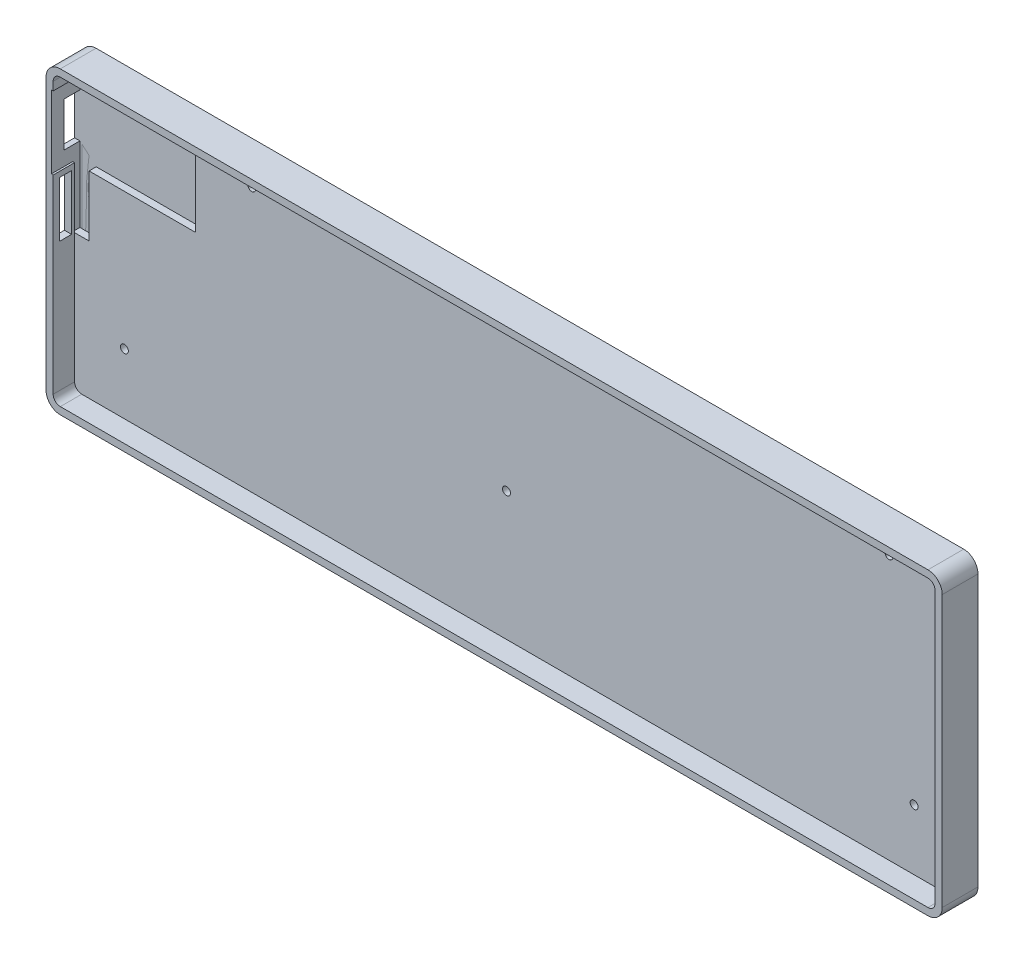
from build123d import *

# Parameters (mm, degrees)
SKETCH1_R                = 1.1
SKETCH1_R_2              = 0.95
SKETCH1_R_3              = 2.05
SKETCH1_R_4              = 1.5
SKETCH1_R_5              = 0.15
SKETCH1_R_6              = 0.5
SKETCH1_R_7              = 0.45
SKETCH1_R_8              = 1.524
SKETCH1_R_9              = 1.9939
SKETCH1_R_10             = 0.375
BOSS_EXTRUDE1_DEPTH      = 1.6
BOSS_EXTRUDE2_DEPTH      = 8
BOSS_EXTRUDE2_DEPTH_BACK = 2
BOSS_EXTRUDE5_DEPTH      = 2
BOSS_EXTRUDE5_DEPTH_BACK = 2
BOSS_EXTRUDE5_START      = 1.6
SKETCH5_R                = 1.105991344
SKETCH5_R_2              = 1.113799343
SKETCH5_R_3              = 1.1
SKETCH6_W                = 32.534762887
SKETCH6_H                = 20.354663213
CUT_EXTRUDE1_DEPTH       = 2
SKETCH7_W                = 4.5
SKETCH7_H                = 12.354663213
CUT_EXTRUDE2_DEPTH       = 313.254874697
CUT_EXTRUDE3_DEPTH       = 10
CUT_EXTRUDE3_DEPTH_BACK  = 2
SKETCH9_W                = 4.56033848
SKETCH9_H                = 16.973436805
CUT_EXTRUDE4_DEPTH       = 2
SKETCH11_W               = 3.429739467
SKETCH11_H               = 15.458393228
CUT_EXTRUDE6_DEPTH       = 2


with BuildPart() as part:
    # Sketch1 → Boss-Extrude1 (new body)
    with BuildSketch(Plane.XY.offset(1.6)):
        with BuildLine():
            Line((342.620001494, -108.45), (99.949998506, -108.45))
            ThreePointArc((99.949998506, -108.45), (98.535786, -109.035786), (97.95, -110.449998506))
            Line((97.95, -110.449998506), (97.95, -186.250001494))
            ThreePointArc((97.95, -186.250001494), (98.535786, -187.664214), (99.949998506, -188.25))
            Line((99.949998506, -188.25), (342.620001494, -188.25))
            ThreePointArc((342.620001494, -188.25), (344.034214, -187.664214), (344.62, -186.250001494))
            Line((344.62, -186.250001494), (344.62, -110.449998506))
            ThreePointArc((344.62, -110.449998506), (344.034214, -109.035786), (342.620001494, -108.45))
        make_face()
        with Locations((325.72, -114.3)):
            Circle(SKETCH1_R, mode=Mode.SUBTRACT)
        with Locations((330.8, -120)):
            Circle(SKETCH1_R_2, mode=Mode.SUBTRACT)
        with Locations((325.72, -120)):
            Circle(SKETCH1_R_3, mode=Mode.SUBTRACT)
        with Locations((320.64, -120)):
            Circle(SKETCH1_R_2, mode=Mode.SUBTRACT)
        with Locations((304.58, -120)):
            Circle(SKETCH1_R_2, mode=Mode.SUBTRACT)
        with Locations((299.5, -120)):
            Circle(SKETCH1_R_3, mode=Mode.SUBTRACT)
        with Locations((294.42, -120)):
            Circle(SKETCH1_R_2, mode=Mode.SUBTRACT)
        with Locations((285.58, -120)):
            Circle(SKETCH1_R_2, mode=Mode.SUBTRACT)
        with Locations((280.5, -120)):
            Circle(SKETCH1_R_3, mode=Mode.SUBTRACT)
        with Locations((329.53, -122.54)):
            Circle(SKETCH1_R_4, mode=Mode.SUBTRACT)
        with Locations((323.18, -125.08)):
            Circle(SKETCH1_R_4, mode=Mode.SUBTRACT)
        with Locations((327.37, -129)):
            Circle(SKETCH1_R_5, mode=Mode.SUBTRACT)
        with Locations((324.07, -129)):
            Circle(SKETCH1_R_5, mode=Mode.SUBTRACT)
        with Locations((303.31, -122.54)):
            Circle(SKETCH1_R_4, mode=Mode.SUBTRACT)
        with Locations((296.96, -125.08)):
            Circle(SKETCH1_R_4, mode=Mode.SUBTRACT)
        with Locations((284.31, -122.54)):
            Circle(SKETCH1_R_4, mode=Mode.SUBTRACT)
        with Locations((301.15, -129)):
            Circle(SKETCH1_R_5, mode=Mode.SUBTRACT)
        with Locations((297.85, -129)):
            Circle(SKETCH1_R_5, mode=Mode.SUBTRACT)
        with Locations((282.15, -129)):
            Circle(SKETCH1_R_5, mode=Mode.SUBTRACT)
        with Locations((275.42, -120)):
            Circle(SKETCH1_R_2, mode=Mode.SUBTRACT)
        with Locations((266.58, -120)):
            Circle(SKETCH1_R_2, mode=Mode.SUBTRACT)
        with Locations((261.5, -120)):
            Circle(SKETCH1_R_3, mode=Mode.SUBTRACT)
        with Locations((256.42, -120)):
            Circle(SKETCH1_R_2, mode=Mode.SUBTRACT)
        with Locations((247.58, -120)):
            Circle(SKETCH1_R_2, mode=Mode.SUBTRACT)
        with Locations((242.5, -120)):
            Circle(SKETCH1_R_3, mode=Mode.SUBTRACT)
        with Locations((237.42, -120)):
            Circle(SKETCH1_R_2, mode=Mode.SUBTRACT)
        with Locations((228.58, -120)):
            Circle(SKETCH1_R_2, mode=Mode.SUBTRACT)
        with Locations((223.5, -120)):
            Circle(SKETCH1_R_3, mode=Mode.SUBTRACT)
        with Locations((265.31, -122.54)):
            Circle(SKETCH1_R_4, mode=Mode.SUBTRACT)
        with Locations((277.96, -125.08)):
            Circle(SKETCH1_R_4, mode=Mode.SUBTRACT)
        with Locations((258.96, -125.08)):
            Circle(SKETCH1_R_4, mode=Mode.SUBTRACT)
        with Locations((278.85, -129)):
            Circle(SKETCH1_R_5, mode=Mode.SUBTRACT)
        with Locations((263.15, -129)):
            Circle(SKETCH1_R_5, mode=Mode.SUBTRACT)
        with Locations((259.85, -129)):
            Circle(SKETCH1_R_5, mode=Mode.SUBTRACT)
        with Locations((246.31, -122.54)):
            Circle(SKETCH1_R_4, mode=Mode.SUBTRACT)
        with Locations((239.96, -125.08)):
            Circle(SKETCH1_R_4, mode=Mode.SUBTRACT)
        with Locations((227.31, -122.54)):
            Circle(SKETCH1_R_4, mode=Mode.SUBTRACT)
        with Locations((220.96, -125.08)):
            Circle(SKETCH1_R_4, mode=Mode.SUBTRACT)
        with Locations((244.15, -129)):
            Circle(SKETCH1_R_5, mode=Mode.SUBTRACT)
        with Locations((240.85, -129)):
            Circle(SKETCH1_R_5, mode=Mode.SUBTRACT)
        with Locations((225.15, -129)):
            Circle(SKETCH1_R_5, mode=Mode.SUBTRACT)
        with Locations((221.85, -129)):
            Circle(SKETCH1_R_5, mode=Mode.SUBTRACT)
        with Locations((333.08, -139)):
            Circle(SKETCH1_R_2, mode=Mode.SUBTRACT)
        with Locations((328, -139)):
            Circle(SKETCH1_R_3, mode=Mode.SUBTRACT)
        with Locations((322.92, -139)):
            Circle(SKETCH1_R_2, mode=Mode.SUBTRACT)
        with Locations((309.33, -139)):
            Circle(SKETCH1_R_2, mode=Mode.SUBTRACT)
        with Locations((304.25, -139)):
            Circle(SKETCH1_R_3, mode=Mode.SUBTRACT)
        with Locations((299.17, -139)):
            Circle(SKETCH1_R_2, mode=Mode.SUBTRACT)
        with Locations((290.33, -139)):
            Circle(SKETCH1_R_2, mode=Mode.SUBTRACT)
        with Locations((285.25, -139)):
            Circle(SKETCH1_R_3, mode=Mode.SUBTRACT)
        with Locations((280.17, -139)):
            Circle(SKETCH1_R_2, mode=Mode.SUBTRACT)
        with Locations((331.81, -141.54)):
            Circle(SKETCH1_R_4, mode=Mode.SUBTRACT)
        with Locations((325.46, -144.08)):
            Circle(SKETCH1_R_4, mode=Mode.SUBTRACT)
        with Locations((329.65, -148)):
            Circle(SKETCH1_R_5, mode=Mode.SUBTRACT)
        with Locations((326.35, -148)):
            Circle(SKETCH1_R_5, mode=Mode.SUBTRACT)
        with Locations((308.06, -141.54)):
            Circle(SKETCH1_R_4, mode=Mode.SUBTRACT)
        with Locations((301.71, -144.08)):
            Circle(SKETCH1_R_4, mode=Mode.SUBTRACT)
        with Locations((289.06, -141.54)):
            Circle(SKETCH1_R_4, mode=Mode.SUBTRACT)
        with Locations((282.71, -144.08)):
            Circle(SKETCH1_R_4, mode=Mode.SUBTRACT)
        with Locations((305.9, -148)):
            Circle(SKETCH1_R_5, mode=Mode.SUBTRACT)
        with Locations((302.6, -148)):
            Circle(SKETCH1_R_5, mode=Mode.SUBTRACT)
        with Locations((286.9, -148)):
            Circle(SKETCH1_R_5, mode=Mode.SUBTRACT)
        with Locations((283.6, -148)):
            Circle(SKETCH1_R_5, mode=Mode.SUBTRACT)
        with Locations((271.33, -139)):
            Circle(SKETCH1_R_2, mode=Mode.SUBTRACT)
        with Locations((266.25, -139)):
            Circle(SKETCH1_R_3, mode=Mode.SUBTRACT)
        with Locations((261.17, -139)):
            Circle(SKETCH1_R_2, mode=Mode.SUBTRACT)
        with Locations((252.33, -139)):
            Circle(SKETCH1_R_2, mode=Mode.SUBTRACT)
        with Locations((247.25, -139)):
            Circle(SKETCH1_R_3, mode=Mode.SUBTRACT)
        with Locations((242.17, -139)):
            Circle(SKETCH1_R_2, mode=Mode.SUBTRACT)
        with Locations((233.33, -139)):
            Circle(SKETCH1_R_2, mode=Mode.SUBTRACT)
        with Locations((228.25, -139)):
            Circle(SKETCH1_R_3, mode=Mode.SUBTRACT)
        with Locations((223.17, -139)):
            Circle(SKETCH1_R_2, mode=Mode.SUBTRACT)
        with Locations((270.06, -141.54)):
            Circle(SKETCH1_R_4, mode=Mode.SUBTRACT)
        with Locations((251.06, -141.54)):
            Circle(SKETCH1_R_4, mode=Mode.SUBTRACT)
        with Locations((263.71, -144.08)):
            Circle(SKETCH1_R_4, mode=Mode.SUBTRACT)
        with Locations((267.9, -148)):
            Circle(SKETCH1_R_5, mode=Mode.SUBTRACT)
        with Locations((264.6, -148)):
            Circle(SKETCH1_R_5, mode=Mode.SUBTRACT)
        with Locations((244.71, -144.08)):
            Circle(SKETCH1_R_4, mode=Mode.SUBTRACT)
        with Locations((232.06, -141.54)):
            Circle(SKETCH1_R_4, mode=Mode.SUBTRACT)
        with Locations((225.71, -144.08)):
            Circle(SKETCH1_R_4, mode=Mode.SUBTRACT)
        with Locations((248.9, -148)):
            Circle(SKETCH1_R_5, mode=Mode.SUBTRACT)
        with Locations((245.6, -148)):
            Circle(SKETCH1_R_5, mode=Mode.SUBTRACT)
        with Locations((229.9, -148)):
            Circle(SKETCH1_R_5, mode=Mode.SUBTRACT)
        with Locations((226.6, -148)):
            Circle(SKETCH1_R_5, mode=Mode.SUBTRACT)
        with Locations((218.42, -120)):
            Circle(SKETCH1_R_2, mode=Mode.SUBTRACT)
        with Locations((209.58, -120)):
            Circle(SKETCH1_R_2, mode=Mode.SUBTRACT)
        with Locations((204.5, -120)):
            Circle(SKETCH1_R_3, mode=Mode.SUBTRACT)
        with Locations((199.42, -120)):
            Circle(SKETCH1_R_2, mode=Mode.SUBTRACT)
        with Locations((190.58, -120)):
            Circle(SKETCH1_R_2, mode=Mode.SUBTRACT)
        with Locations((185.5, -120)):
            Circle(SKETCH1_R_3, mode=Mode.SUBTRACT)
        with Locations((180.42, -120)):
            Circle(SKETCH1_R_2, mode=Mode.SUBTRACT)
        with Locations((171.58, -120)):
            Circle(SKETCH1_R_2, mode=Mode.SUBTRACT)
        with Locations((166.5, -120)):
            Circle(SKETCH1_R_3, mode=Mode.SUBTRACT)
        with Locations((161.42, -120)):
            Circle(SKETCH1_R_2, mode=Mode.SUBTRACT)
        with Locations((208.31, -122.54)):
            Circle(SKETCH1_R_4, mode=Mode.SUBTRACT)
        with Locations((189.31, -122.54)):
            Circle(SKETCH1_R_4, mode=Mode.SUBTRACT)
        with Locations((201.96, -125.08)):
            Circle(SKETCH1_R_4, mode=Mode.SUBTRACT)
        with Locations((206.15, -129)):
            Circle(SKETCH1_R_5, mode=Mode.SUBTRACT)
        with Locations((202.85, -129)):
            Circle(SKETCH1_R_5, mode=Mode.SUBTRACT)
        with Locations((182.96, -125.08)):
            Circle(SKETCH1_R_4, mode=Mode.SUBTRACT)
        with Locations((170.31, -122.54)):
            Circle(SKETCH1_R_4, mode=Mode.SUBTRACT)
        with Locations((163.96, -125.08)):
            Circle(SKETCH1_R_4, mode=Mode.SUBTRACT)
        with Locations((187.15, -129)):
            Circle(SKETCH1_R_5, mode=Mode.SUBTRACT)
        with Locations((183.85, -129)):
            Circle(SKETCH1_R_5, mode=Mode.SUBTRACT)
        with Locations((168.15, -129)):
            Circle(SKETCH1_R_5, mode=Mode.SUBTRACT)
        with Locations((164.85, -129)):
            Circle(SKETCH1_R_5, mode=Mode.SUBTRACT)
        with Locations((147.5, -114.3)):
            Circle(SKETCH1_R, mode=Mode.SUBTRACT)
        with Locations((129.49, -115.23)):
            Circle(SKETCH1_R_6, mode=Mode.SUBTRACT)
        with Locations((152.58, -120)):
            Circle(SKETCH1_R_2, mode=Mode.SUBTRACT)
        with Locations((147.5, -120)):
            Circle(SKETCH1_R_3, mode=Mode.SUBTRACT)
        with Locations((142.42, -120)):
            Circle(SKETCH1_R_2, mode=Mode.SUBTRACT)
        with Locations((133.58, -120)):
            Circle(SKETCH1_R_2, mode=Mode.SUBTRACT)
        with Locations((126.95, -115.23)):
            Circle(SKETCH1_R_6, mode=Mode.SUBTRACT)
        with Locations((124.41, -115.23)):
            Circle(SKETCH1_R_6, mode=Mode.SUBTRACT)
        with Locations((121.87, -115.23)):
            Circle(SKETCH1_R_6, mode=Mode.SUBTRACT)
        with Locations((119.33, -115.23)):
            Circle(SKETCH1_R_6, mode=Mode.SUBTRACT)
        with Locations((116.79, -115.23)):
            Circle(SKETCH1_R_6, mode=Mode.SUBTRACT)
        with Locations((114.25, -115.23)):
            Circle(SKETCH1_R_6, mode=Mode.SUBTRACT)
        with Locations((111.71, -115.23)):
            Circle(SKETCH1_R_6, mode=Mode.SUBTRACT)
        with Locations((109.17, -115.23)):
            Circle(SKETCH1_R_6, mode=Mode.SUBTRACT)
        with Locations((106.63, -115.23)):
            Circle(SKETCH1_R_6, mode=Mode.SUBTRACT)
        with Locations((104.09, -115.23)):
            Circle(SKETCH1_R_6, mode=Mode.SUBTRACT)
        with Locations((101.55, -115.23)):
            Circle(SKETCH1_R_6, mode=Mode.SUBTRACT)
        with Locations((128.5, -120)):
            Circle(SKETCH1_R_3, mode=Mode.SUBTRACT)
        with Locations((123.42, -120)):
            Circle(SKETCH1_R_2, mode=Mode.SUBTRACT)
        with Locations((114.58, -120)):
            Circle(SKETCH1_R_2, mode=Mode.SUBTRACT)
        with Locations((120.05, -121.150002)):
            Circle(SKETCH1_R_5, mode=Mode.SUBTRACT)
        with Locations((109.5, -120)):
            Circle(SKETCH1_R_3, mode=Mode.SUBTRACT)
        with Locations((104.42, -120)):
            Circle(SKETCH1_R_2, mode=Mode.SUBTRACT)
        with Locations((100.875, -120.825002)):
            Circle(SKETCH1_R_5, mode=Mode.SUBTRACT)
        with Locations((151.31, -122.54)):
            Circle(SKETCH1_R_4, mode=Mode.SUBTRACT)
        with Locations((144.96, -125.08)):
            Circle(SKETCH1_R_4, mode=Mode.SUBTRACT)
        with Locations((132.31, -122.54)):
            Circle(SKETCH1_R_4, mode=Mode.SUBTRACT)
        with Locations((149.15, -129)):
            Circle(SKETCH1_R_5, mode=Mode.SUBTRACT)
        with Locations((145.85, -129)):
            Circle(SKETCH1_R_5, mode=Mode.SUBTRACT)
        with Locations((129.49, -130.47)):
            Circle(SKETCH1_R_6, mode=Mode.SUBTRACT)
        with Locations((120.05, -124.449998)):
            Circle(SKETCH1_R_5, mode=Mode.SUBTRACT)
        with Locations((125.96, -125.08)):
            Circle(SKETCH1_R_4, mode=Mode.SUBTRACT)
        with Locations((113.31, -122.54)):
            Circle(SKETCH1_R_4, mode=Mode.SUBTRACT)
        with Locations((100.875, -124.124998)):
            Circle(SKETCH1_R_5, mode=Mode.SUBTRACT)
        with Locations((106.96, -125.08)):
            Circle(SKETCH1_R_4, mode=Mode.SUBTRACT)
        with Locations((126.95, -130.47)):
            Circle(SKETCH1_R_6, mode=Mode.SUBTRACT)
        with Locations((124.41, -130.47)):
            Circle(SKETCH1_R_6, mode=Mode.SUBTRACT)
        with Locations((121.87, -130.47)):
            Circle(SKETCH1_R_6, mode=Mode.SUBTRACT)
        with Locations((119.33, -130.47)):
            Circle(SKETCH1_R_6, mode=Mode.SUBTRACT)
        with Locations((116.79, -130.47)):
            Circle(SKETCH1_R_6, mode=Mode.SUBTRACT)
        with Locations((114.25, -130.47)):
            Circle(SKETCH1_R_6, mode=Mode.SUBTRACT)
        with Locations((111.71, -130.47)):
            Circle(SKETCH1_R_6, mode=Mode.SUBTRACT)
        with Locations((109.17, -130.47)):
            Circle(SKETCH1_R_6, mode=Mode.SUBTRACT)
        with Locations((106.63, -130.47)):
            Circle(SKETCH1_R_6, mode=Mode.SUBTRACT)
        with Locations((104.09, -130.47)):
            Circle(SKETCH1_R_6, mode=Mode.SUBTRACT)
        with Locations((101.55, -130.47)):
            Circle(SKETCH1_R_6, mode=Mode.SUBTRACT)
        with Locations((214.33, -139)):
            Circle(SKETCH1_R_2, mode=Mode.SUBTRACT)
        with Locations((209.25, -139)):
            Circle(SKETCH1_R_3, mode=Mode.SUBTRACT)
        with Locations((204.17, -139)):
            Circle(SKETCH1_R_2, mode=Mode.SUBTRACT)
        with Locations((195.33, -139)):
            Circle(SKETCH1_R_2, mode=Mode.SUBTRACT)
        with Locations((190.25, -139)):
            Circle(SKETCH1_R_3, mode=Mode.SUBTRACT)
        with Locations((185.17, -139)):
            Circle(SKETCH1_R_2, mode=Mode.SUBTRACT)
        with Locations((176.33, -139)):
            Circle(SKETCH1_R_2, mode=Mode.SUBTRACT)
        with Locations((171.25, -139)):
            Circle(SKETCH1_R_3, mode=Mode.SUBTRACT)
        with Locations((166.17, -139)):
            Circle(SKETCH1_R_2, mode=Mode.SUBTRACT)
        with Locations((213.06, -141.54)):
            Circle(SKETCH1_R_4, mode=Mode.SUBTRACT)
        with Locations((206.71, -144.08)):
            Circle(SKETCH1_R_4, mode=Mode.SUBTRACT)
        with Locations((194.06, -141.54)):
            Circle(SKETCH1_R_4, mode=Mode.SUBTRACT)
        with Locations((210.9, -148)):
            Circle(SKETCH1_R_5, mode=Mode.SUBTRACT)
        with Locations((207.6, -148)):
            Circle(SKETCH1_R_5, mode=Mode.SUBTRACT)
        with Locations((191.9, -148)):
            Circle(SKETCH1_R_5, mode=Mode.SUBTRACT)
        with Locations((175.06, -141.54)):
            Circle(SKETCH1_R_4, mode=Mode.SUBTRACT)
        with Locations((187.71, -144.08)):
            Circle(SKETCH1_R_4, mode=Mode.SUBTRACT)
        with Locations((168.71, -144.08)):
            Circle(SKETCH1_R_4, mode=Mode.SUBTRACT)
        with Locations((188.6, -148)):
            Circle(SKETCH1_R_5, mode=Mode.SUBTRACT)
        with Locations((172.9, -148)):
            Circle(SKETCH1_R_5, mode=Mode.SUBTRACT)
        with Locations((169.6, -148)):
            Circle(SKETCH1_R_5, mode=Mode.SUBTRACT)
        with Locations((157.33, -139)):
            Circle(SKETCH1_R_2, mode=Mode.SUBTRACT)
        with Locations((152.25, -139)):
            Circle(SKETCH1_R_3, mode=Mode.SUBTRACT)
        with Locations((147.17, -139)):
            Circle(SKETCH1_R_2, mode=Mode.SUBTRACT)
        with Locations((138.33, -139)):
            Circle(SKETCH1_R_2, mode=Mode.SUBTRACT)
        with Locations((133.25, -139)):
            Circle(SKETCH1_R_3, mode=Mode.SUBTRACT)
        with Locations((128.17, -139)):
            Circle(SKETCH1_R_2, mode=Mode.SUBTRACT)
        with Locations((116.955, -139)):
            Circle(SKETCH1_R_2, mode=Mode.SUBTRACT)
        with Locations((99.78, -137.775)):
            Circle(SKETCH1_R_7, mode=Mode.SUBTRACT)
        with Locations((111.875, -139)):
            Circle(SKETCH1_R_3, mode=Mode.SUBTRACT)
        with Locations((106.795, -139)):
            Circle(SKETCH1_R_2, mode=Mode.SUBTRACT)
        with Locations((99.78, -140.775)):
            Circle(SKETCH1_R_7, mode=Mode.SUBTRACT)
        with Locations((156.06, -141.54)):
            Circle(SKETCH1_R_4, mode=Mode.SUBTRACT)
        with Locations((149.71, -144.08)):
            Circle(SKETCH1_R_4, mode=Mode.SUBTRACT)
        with Locations((137.06, -141.54)):
            Circle(SKETCH1_R_4, mode=Mode.SUBTRACT)
        with Locations((130.71, -144.08)):
            Circle(SKETCH1_R_4, mode=Mode.SUBTRACT)
        with Locations((153.9, -148)):
            Circle(SKETCH1_R_5, mode=Mode.SUBTRACT)
        with Locations((150.6, -148)):
            Circle(SKETCH1_R_5, mode=Mode.SUBTRACT)
        with Locations((134.9, -148)):
            Circle(SKETCH1_R_5, mode=Mode.SUBTRACT)
        with Locations((131.6, -148)):
            Circle(SKETCH1_R_5, mode=Mode.SUBTRACT)
        with Locations((115.685, -141.54)):
            Circle(SKETCH1_R_4, mode=Mode.SUBTRACT)
        with Locations((109.335, -144.08)):
            Circle(SKETCH1_R_4, mode=Mode.SUBTRACT)
        with Locations((113.525, -148)):
            Circle(SKETCH1_R_5, mode=Mode.SUBTRACT)
        with Locations((110.225, -148)):
            Circle(SKETCH1_R_5, mode=Mode.SUBTRACT)
        with Locations((337.83, -158)):
            Circle(SKETCH1_R_2, mode=Mode.SUBTRACT)
        with Locations((332.75, -158)):
            Circle(SKETCH1_R_3, mode=Mode.SUBTRACT)
        with Locations((327.67, -158)):
            Circle(SKETCH1_R_2, mode=Mode.SUBTRACT)
        with Locations((318.83, -158)):
            Circle(SKETCH1_R_2, mode=Mode.SUBTRACT)
        with Locations((313.75, -158)):
            Circle(SKETCH1_R_3, mode=Mode.SUBTRACT)
        with Locations((308.67, -158)):
            Circle(SKETCH1_R_2, mode=Mode.SUBTRACT)
        with Locations((299.83, -158)):
            Circle(SKETCH1_R_2, mode=Mode.SUBTRACT)
        with Locations((294.75, -158)):
            Circle(SKETCH1_R_3, mode=Mode.SUBTRACT)
        with Locations((289.67, -158)):
            Circle(SKETCH1_R_2, mode=Mode.SUBTRACT)
        with Locations((280.83, -158)):
            Circle(SKETCH1_R_2, mode=Mode.SUBTRACT)
        with Locations((336.56, -160.54)):
            Circle(SKETCH1_R_4, mode=Mode.SUBTRACT)
        with Locations((330.21, -163.08)):
            Circle(SKETCH1_R_4, mode=Mode.SUBTRACT)
        with Locations((317.56, -160.54)):
            Circle(SKETCH1_R_4, mode=Mode.SUBTRACT)
        with Locations((311.21, -163.08)):
            Circle(SKETCH1_R_4, mode=Mode.SUBTRACT)
        with Locations((334.4, -167)):
            Circle(SKETCH1_R_5, mode=Mode.SUBTRACT)
        with Locations((331.1, -167)):
            Circle(SKETCH1_R_5, mode=Mode.SUBTRACT)
        with Locations((315.4, -167)):
            Circle(SKETCH1_R_5, mode=Mode.SUBTRACT)
        with Locations((312.1, -167)):
            Circle(SKETCH1_R_5, mode=Mode.SUBTRACT)
        with Locations((298.56, -160.54)):
            Circle(SKETCH1_R_4, mode=Mode.SUBTRACT)
        with Locations((279.56, -160.54)):
            Circle(SKETCH1_R_4, mode=Mode.SUBTRACT)
        with Locations((292.21, -163.08)):
            Circle(SKETCH1_R_4, mode=Mode.SUBTRACT)
        with Locations((296.4, -167)):
            Circle(SKETCH1_R_5, mode=Mode.SUBTRACT)
        with Locations((293.1, -167)):
            Circle(SKETCH1_R_5, mode=Mode.SUBTRACT)
        with Locations((275.75, -158)):
            Circle(SKETCH1_R_3, mode=Mode.SUBTRACT)
        with Locations((270.67, -158)):
            Circle(SKETCH1_R_2, mode=Mode.SUBTRACT)
        with Locations((261.83, -158)):
            Circle(SKETCH1_R_2, mode=Mode.SUBTRACT)
        with Locations((256.75, -158)):
            Circle(SKETCH1_R_3, mode=Mode.SUBTRACT)
        with Locations((251.67, -158)):
            Circle(SKETCH1_R_2, mode=Mode.SUBTRACT)
        with Locations((242.83, -158)):
            Circle(SKETCH1_R_2, mode=Mode.SUBTRACT)
        with Locations((237.75, -158)):
            Circle(SKETCH1_R_3, mode=Mode.SUBTRACT)
        with Locations((232.67, -158)):
            Circle(SKETCH1_R_2, mode=Mode.SUBTRACT)
        with Locations((223.83, -158)):
            Circle(SKETCH1_R_2, mode=Mode.SUBTRACT)
        with Locations((273.21, -163.08)):
            Circle(SKETCH1_R_4, mode=Mode.SUBTRACT)
        with Locations((260.56, -160.54)):
            Circle(SKETCH1_R_4, mode=Mode.SUBTRACT)
        with Locations((254.21, -163.08)):
            Circle(SKETCH1_R_4, mode=Mode.SUBTRACT)
        with Locations((277.4, -167)):
            Circle(SKETCH1_R_5, mode=Mode.SUBTRACT)
        with Locations((274.1, -167)):
            Circle(SKETCH1_R_5, mode=Mode.SUBTRACT)
        with Locations((258.4, -167)):
            Circle(SKETCH1_R_5, mode=Mode.SUBTRACT)
        with Locations((255.1, -167)):
            Circle(SKETCH1_R_5, mode=Mode.SUBTRACT)
        with Locations((241.56, -160.54)):
            Circle(SKETCH1_R_4, mode=Mode.SUBTRACT)
        with Locations((235.21, -163.08)):
            Circle(SKETCH1_R_4, mode=Mode.SUBTRACT)
        with Locations((222.56, -160.54)):
            Circle(SKETCH1_R_4, mode=Mode.SUBTRACT)
        with Locations((239.4, -167)):
            Circle(SKETCH1_R_5, mode=Mode.SUBTRACT)
        with Locations((236.1, -167)):
            Circle(SKETCH1_R_5, mode=Mode.SUBTRACT)
        with Locations((220.4, -167)):
            Circle(SKETCH1_R_5, mode=Mode.SUBTRACT)
        with Locations((332.75, -171.3)):
            Circle(SKETCH1_R, mode=Mode.SUBTRACT)
        with Locations((337.83, -177)):
            Circle(SKETCH1_R_2, mode=Mode.SUBTRACT)
        with Locations((332.75, -177)):
            Circle(SKETCH1_R_3, mode=Mode.SUBTRACT)
        with Locations((327.67, -177)):
            Circle(SKETCH1_R_2, mode=Mode.SUBTRACT)
        with Locations((318.83, -177)):
            Circle(SKETCH1_R_2, mode=Mode.SUBTRACT)
        with Locations((313.75, -177)):
            Circle(SKETCH1_R_3, mode=Mode.SUBTRACT)
        with Locations((308.67, -177)):
            Circle(SKETCH1_R_2, mode=Mode.SUBTRACT)
        with Locations((299.83, -177)):
            Circle(SKETCH1_R_2, mode=Mode.SUBTRACT)
        with Locations((294.75, -177)):
            Circle(SKETCH1_R_3, mode=Mode.SUBTRACT)
        with Locations((289.67, -177)):
            Circle(SKETCH1_R_2, mode=Mode.SUBTRACT)
        with Locations((280.83, -177)):
            Circle(SKETCH1_R_2, mode=Mode.SUBTRACT)
        with Locations((336.56, -179.54)):
            Circle(SKETCH1_R_4, mode=Mode.SUBTRACT)
        with Locations((330.21, -182.08)):
            Circle(SKETCH1_R_4, mode=Mode.SUBTRACT)
        with Locations((317.56, -179.54)):
            Circle(SKETCH1_R_4, mode=Mode.SUBTRACT)
        with Locations((311.21, -182.08)):
            Circle(SKETCH1_R_4, mode=Mode.SUBTRACT)
        with Locations((334.4, -186)):
            Circle(SKETCH1_R_5, mode=Mode.SUBTRACT)
        with Locations((331.1, -186)):
            Circle(SKETCH1_R_5, mode=Mode.SUBTRACT)
        with Locations((315.4, -186)):
            Circle(SKETCH1_R_5, mode=Mode.SUBTRACT)
        with Locations((312.1, -186)):
            Circle(SKETCH1_R_5, mode=Mode.SUBTRACT)
        with Locations((298.56, -179.54)):
            Circle(SKETCH1_R_4, mode=Mode.SUBTRACT)
        with Locations((279.56, -179.54)):
            Circle(SKETCH1_R_4, mode=Mode.SUBTRACT)
        with Locations((292.21, -182.08)):
            Circle(SKETCH1_R_4, mode=Mode.SUBTRACT)
        with Locations((296.4, -186)):
            Circle(SKETCH1_R_5, mode=Mode.SUBTRACT)
        with Locations((293.1, -186)):
            Circle(SKETCH1_R_5, mode=Mode.SUBTRACT)
        with Locations((256.813, -170.015)):
            Circle(SKETCH1_R_8, mode=Mode.SUBTRACT)
        with Locations((275.75, -177)):
            Circle(SKETCH1_R_3, mode=Mode.SUBTRACT)
        with Locations((270.67, -177)):
            Circle(SKETCH1_R_2, mode=Mode.SUBTRACT)
        with Locations((249.955, -177)):
            Circle(SKETCH1_R_2, mode=Mode.SUBTRACT)
        with Locations((232.937, -170.015)):
            Circle(SKETCH1_R_8, mode=Mode.SUBTRACT)
        with Locations((244.875, -177)):
            Circle(SKETCH1_R_3, mode=Mode.SUBTRACT)
        with Locations((239.795, -177)):
            Circle(SKETCH1_R_2, mode=Mode.SUBTRACT)
        with Locations((273.21, -182.08)):
            Circle(SKETCH1_R_4, mode=Mode.SUBTRACT)
        with Locations((277.4, -186)):
            Circle(SKETCH1_R_5, mode=Mode.SUBTRACT)
        with Locations((274.1, -186)):
            Circle(SKETCH1_R_5, mode=Mode.SUBTRACT)
        with Locations((256.813, -185.225)):
            Circle(SKETCH1_R_9, mode=Mode.SUBTRACT)
        with Locations((248.685, -179.54)):
            Circle(SKETCH1_R_4, mode=Mode.SUBTRACT)
        with Locations((242.335, -182.08)):
            Circle(SKETCH1_R_4, mode=Mode.SUBTRACT)
        with Locations((246.525, -186)):
            Circle(SKETCH1_R_5, mode=Mode.SUBTRACT)
        with Locations((243.225, -186)):
            Circle(SKETCH1_R_5, mode=Mode.SUBTRACT)
        with Locations((232.937, -185.225)):
            Circle(SKETCH1_R_9, mode=Mode.SUBTRACT)
        with Locations((218.75, -152.3)):
            Circle(SKETCH1_R, mode=Mode.SUBTRACT)
        with Locations((218.75, -158)):
            Circle(SKETCH1_R_3, mode=Mode.SUBTRACT)
        with Locations((213.67, -158)):
            Circle(SKETCH1_R_2, mode=Mode.SUBTRACT)
        with Locations((204.83, -158)):
            Circle(SKETCH1_R_2, mode=Mode.SUBTRACT)
        with Locations((199.75, -158)):
            Circle(SKETCH1_R_3, mode=Mode.SUBTRACT)
        with Locations((194.67, -158)):
            Circle(SKETCH1_R_2, mode=Mode.SUBTRACT)
        with Locations((185.83, -158)):
            Circle(SKETCH1_R_2, mode=Mode.SUBTRACT)
        with Locations((180.75, -158)):
            Circle(SKETCH1_R_3, mode=Mode.SUBTRACT)
        with Locations((175.67, -158)):
            Circle(SKETCH1_R_2, mode=Mode.SUBTRACT)
        with Locations((166.83, -158)):
            Circle(SKETCH1_R_2, mode=Mode.SUBTRACT)
        with Locations((161.75, -158)):
            Circle(SKETCH1_R_3, mode=Mode.SUBTRACT)
        with Locations((216.21, -163.08)):
            Circle(SKETCH1_R_4, mode=Mode.SUBTRACT)
        with Locations((203.56, -160.54)):
            Circle(SKETCH1_R_4, mode=Mode.SUBTRACT)
        with Locations((197.21, -163.08)):
            Circle(SKETCH1_R_4, mode=Mode.SUBTRACT)
        with Locations((217.1, -167)):
            Circle(SKETCH1_R_5, mode=Mode.SUBTRACT)
        with Locations((201.4, -167)):
            Circle(SKETCH1_R_5, mode=Mode.SUBTRACT)
        with Locations((198.1, -167)):
            Circle(SKETCH1_R_5, mode=Mode.SUBTRACT)
        with Locations((184.56, -160.54)):
            Circle(SKETCH1_R_4, mode=Mode.SUBTRACT)
        with Locations((178.21, -163.08)):
            Circle(SKETCH1_R_4, mode=Mode.SUBTRACT)
        with Locations((165.56, -160.54)):
            Circle(SKETCH1_R_4, mode=Mode.SUBTRACT)
        with Locations((159.21, -163.08)):
            Circle(SKETCH1_R_4, mode=Mode.SUBTRACT)
        with Locations((182.4, -167)):
            Circle(SKETCH1_R_5, mode=Mode.SUBTRACT)
        with Locations((179.1, -167)):
            Circle(SKETCH1_R_5, mode=Mode.SUBTRACT)
        with Locations((163.4, -167)):
            Circle(SKETCH1_R_5, mode=Mode.SUBTRACT)
        with Locations((160.1, -167)):
            Circle(SKETCH1_R_5, mode=Mode.SUBTRACT)
        with Locations((130.6, -154.325)):
            Circle(SKETCH1_R_10, mode=Mode.SUBTRACT)
        with Locations((156.67, -158)):
            Circle(SKETCH1_R_2, mode=Mode.SUBTRACT)
        with Locations((147.83, -158)):
            Circle(SKETCH1_R_2, mode=Mode.SUBTRACT)
        with Locations((142.75, -158)):
            Circle(SKETCH1_R_3, mode=Mode.SUBTRACT)
        with Locations((137.67, -158)):
            Circle(SKETCH1_R_2, mode=Mode.SUBTRACT)
        with Locations((128.6, -154.325)):
            Circle(SKETCH1_R_10, mode=Mode.SUBTRACT)
        with Locations((121.705, -158)):
            Circle(SKETCH1_R_2, mode=Mode.SUBTRACT)
        with Locations((116.625, -158)):
            Circle(SKETCH1_R_3, mode=Mode.SUBTRACT)
        with Locations((111.545, -158)):
            Circle(SKETCH1_R_2, mode=Mode.SUBTRACT)
        with Locations((146.56, -160.54)):
            Circle(SKETCH1_R_4, mode=Mode.SUBTRACT)
        with Locations((140.21, -163.08)):
            Circle(SKETCH1_R_4, mode=Mode.SUBTRACT)
        with Locations((144.4, -167)):
            Circle(SKETCH1_R_5, mode=Mode.SUBTRACT)
        with Locations((141.1, -167)):
            Circle(SKETCH1_R_5, mode=Mode.SUBTRACT)
        with Locations((120.435, -160.54)):
            Circle(SKETCH1_R_4, mode=Mode.SUBTRACT)
        with Locations((114.085, -163.08)):
            Circle(SKETCH1_R_4, mode=Mode.SUBTRACT)
        with Locations((118.275, -167)):
            Circle(SKETCH1_R_5, mode=Mode.SUBTRACT)
        with Locations((114.975, -167)):
            Circle(SKETCH1_R_5, mode=Mode.SUBTRACT)
        with Locations((209.313, -170.04)):
            Circle(SKETCH1_R_8, mode=Mode.SUBTRACT)
        with Locations((202.455, -177)):
            Circle(SKETCH1_R_2, mode=Mode.SUBTRACT)
        with Locations((197.375, -177)):
            Circle(SKETCH1_R_3, mode=Mode.SUBTRACT)
        with Locations((192.295, -177)):
            Circle(SKETCH1_R_2, mode=Mode.SUBTRACT)
        with Locations((185.437, -170.04)):
            Circle(SKETCH1_R_8, mode=Mode.SUBTRACT)
        with Locations((164.455, -177)):
            Circle(SKETCH1_R_2, mode=Mode.SUBTRACT)
        with Locations((159.375, -177)):
            Circle(SKETCH1_R_3, mode=Mode.SUBTRACT)
        with Locations((201.185, -179.54)):
            Circle(SKETCH1_R_4, mode=Mode.SUBTRACT)
        with Locations((194.835, -182.08)):
            Circle(SKETCH1_R_4, mode=Mode.SUBTRACT)
        with Locations((209.313, -185.25)):
            Circle(SKETCH1_R_9, mode=Mode.SUBTRACT)
        with Locations((199.025, -186)):
            Circle(SKETCH1_R_5, mode=Mode.SUBTRACT)
        with Locations((195.725, -186)):
            Circle(SKETCH1_R_5, mode=Mode.SUBTRACT)
        with Locations((163.185, -179.54)):
            Circle(SKETCH1_R_4, mode=Mode.SUBTRACT)
        with Locations((185.437, -185.25)):
            Circle(SKETCH1_R_9, mode=Mode.SUBTRACT)
        with Locations((161.025, -186)):
            Circle(SKETCH1_R_5, mode=Mode.SUBTRACT)
        with Locations((154.295, -177)):
            Circle(SKETCH1_R_2, mode=Mode.SUBTRACT)
        with Locations((140.705, -177)):
            Circle(SKETCH1_R_2, mode=Mode.SUBTRACT)
        with Locations((135.625, -177)):
            Circle(SKETCH1_R_3, mode=Mode.SUBTRACT)
        with Locations((130.545, -177)):
            Circle(SKETCH1_R_2, mode=Mode.SUBTRACT)
        with Locations((111.875, -171.3)):
            Circle(SKETCH1_R, mode=Mode.SUBTRACT)
        with Locations((116.955, -177)):
            Circle(SKETCH1_R_2, mode=Mode.SUBTRACT)
        with Locations((111.875, -177)):
            Circle(SKETCH1_R_3, mode=Mode.SUBTRACT)
        with Locations((106.795, -177)):
            Circle(SKETCH1_R_2, mode=Mode.SUBTRACT)
        with Locations((156.835, -182.08)):
            Circle(SKETCH1_R_4, mode=Mode.SUBTRACT)
        with Locations((139.435, -179.54)):
            Circle(SKETCH1_R_4, mode=Mode.SUBTRACT)
        with Locations((133.085, -182.08)):
            Circle(SKETCH1_R_4, mode=Mode.SUBTRACT)
        with Locations((157.725, -186)):
            Circle(SKETCH1_R_5, mode=Mode.SUBTRACT)
        with Locations((137.275, -186)):
            Circle(SKETCH1_R_5, mode=Mode.SUBTRACT)
        with Locations((133.975, -186)):
            Circle(SKETCH1_R_5, mode=Mode.SUBTRACT)
        with Locations((115.685, -179.54)):
            Circle(SKETCH1_R_4, mode=Mode.SUBTRACT)
        with Locations((109.335, -182.08)):
            Circle(SKETCH1_R_4, mode=Mode.SUBTRACT)
        with Locations((113.525, -186)):
            Circle(SKETCH1_R_5, mode=Mode.SUBTRACT)
        with Locations((110.225, -186)):
            Circle(SKETCH1_R_5, mode=Mode.SUBTRACT)
    extrude(amount=-BOSS_EXTRUDE1_DEPTH)


with BuildPart() as body_2:
    # Sketch2 → Boss-Extrude2 (new, two sides: drawn at the far end of the back side and taken through both)
    with BuildSketch(Plane.XY.offset(1.6).offset(-BOSS_EXTRUDE2_DEPTH_BACK)):
        with BuildLine():
            Line((342.620001494, -106.45), (99.949998506, -106.45))
            ThreePointArc((99.949998506, -106.45), (97.121572438, -107.621572438), (95.95, -110.449998506))
            Line((95.95, -110.449998506), (95.95, -186.250001494))
            ThreePointArc((95.95, -186.250001494), (97.121572438, -189.078427562), (99.949998506, -190.25))
            Line((99.949998506, -190.25), (342.620001494, -190.25))
            ThreePointArc((342.620001494, -190.25), (345.448427562, -189.078427562), (346.62, -186.250001494))
            Line((346.62, -186.250001494), (346.62, -110.449998506))
            ThreePointArc((346.62, -110.449998506), (345.448427562, -107.621572438), (342.620001494, -106.45))
        make_face()
        with BuildLine():
            ThreePointArc((97.95, -110.449998506), (98.535786, -109.035786), (99.949998506, -108.45))
            Line((99.949998506, -108.45), (342.620001494, -108.45))
            ThreePointArc((342.620001494, -108.45), (344.034214, -109.035786), (344.62, -110.449998506))
            Line((344.62, -110.449998506), (344.62, -186.250001494))
            ThreePointArc((344.62, -186.250001494), (344.034214, -187.664214), (342.620001494, -188.25))
            Line((342.620001494, -188.25), (99.949998506, -188.25))
            ThreePointArc((99.949998506, -188.25), (98.535786, -187.664214), (97.95, -186.250001494))
            Line((97.95, -186.250001494), (97.95, -110.449998506))
        make_face(mode=Mode.SUBTRACT)
    extrude(amount=BOSS_EXTRUDE2_DEPTH + BOSS_EXTRUDE2_DEPTH_BACK)

    # Sketch5 → Boss-Extrude5 (add, two sides: drawn at the far end of the back side and taken through both)
    with BuildSketch(Plane.XY.offset(BOSS_EXTRUDE5_START - BOSS_EXTRUDE5_DEPTH_BACK)):
        with BuildLine():
            Line((342.620001494, -108.45), (99.949998506, -108.45))
            ThreePointArc((99.949998506, -108.45), (98.535786, -109.035786), (97.95, -110.449998506))
            Line((97.95, -110.449998506), (97.95, -186.250001494))
            ThreePointArc((97.95, -186.250001494), (98.535786, -187.664214), (99.949998506, -188.25))
            Line((99.949998506, -188.25), (342.620001494, -188.25))
            ThreePointArc((342.620001494, -188.25), (344.034214, -187.664214), (344.62, -186.250001494))
            Line((344.62, -186.250001494), (344.62, -110.449998506))
            ThreePointArc((344.62, -110.449998506), (344.034214, -109.035786), (342.620001494, -108.45))
        make_face()
        with Locations((111.875, -171.3)):
            Circle(SKETCH5_R, mode=Mode.SUBTRACT)
        with Locations((218.75, -152.3)):
            Circle(SKETCH5_R_2, mode=Mode.SUBTRACT)
        with Locations((332.75, -171.3)):
            Circle(SKETCH5_R_3, mode=Mode.SUBTRACT)
        with Locations((147.5, -114.3)):
            Circle(SKETCH5_R_3, mode=Mode.SUBTRACT)
        with Locations((325.72, -114.3)):
            Circle(SKETCH5_R_3, mode=Mode.SUBTRACT)
    extrude(amount=BOSS_EXTRUDE5_DEPTH + BOSS_EXTRUDE5_DEPTH_BACK)

    # Sketch6 → Cut-Extrude1 (cut)
    with BuildSketch(Plane.XY.offset(3.6)):
        with Locations((115.468941808, -122.970077656)):
            Rectangle(SKETCH6_W, SKETCH6_H)
    extrude(amount=-CUT_EXTRUDE1_DEPTH, mode=Mode.SUBTRACT)

    # Sketch7 → Cut-Extrude2 (cut, through all)
    with BuildSketch(Plane(origin=(99.201560364, 0, 0), x_dir=(0, 0, -1), z_dir=(1, 0, 0))):
        with Locations((-3.85, -122.970077656)):
            Rectangle(SKETCH7_W, SKETCH7_H)
    extrude(amount=-CUT_EXTRUDE2_DEPTH, mode=Mode.SUBTRACT)

    # Sketch8 → Cut-Extrude3 (cut, two sides: drawn at the far end of the back side and taken through both)
    with BuildSketch(Plane.XY.offset(3.6).offset(-CUT_EXTRUDE3_DEPTH_BACK)):
        Polygon((99.201560364, -112.792746049), (97.439270013, -112.792746049), (97.439270013, -133.154581373), (99.201560364, -133.147409262), align=None)
    extrude(amount=CUT_EXTRUDE3_DEPTH + CUT_EXTRUDE3_DEPTH_BACK, mode=Mode.SUBTRACT)

    # Sketch9 → Cut-Extrude4 (cut)
    with BuildSketch(Plane.XY.offset(3.6)):
        with Locations((99.719439253, -141.634127664)):
            Rectangle(SKETCH9_W, SKETCH9_H)
    extrude(amount=-CUT_EXTRUDE4_DEPTH, mode=Mode.SUBTRACT)

    # Sketch11 → Cut-Extrude6 (cut)
    with BuildSketch(Plane(origin=(97.95, 0, 0), x_dir=(0, 0, -1), z_dir=(1, 0, 0))):
        with Locations((-6.157355171, -142.384615413)):
            Rectangle(SKETCH11_W, SKETCH11_H)
    extrude(amount=-CUT_EXTRUDE6_DEPTH, mode=Mode.SUBTRACT)


solid = Compound([part.part, body_2.part])
